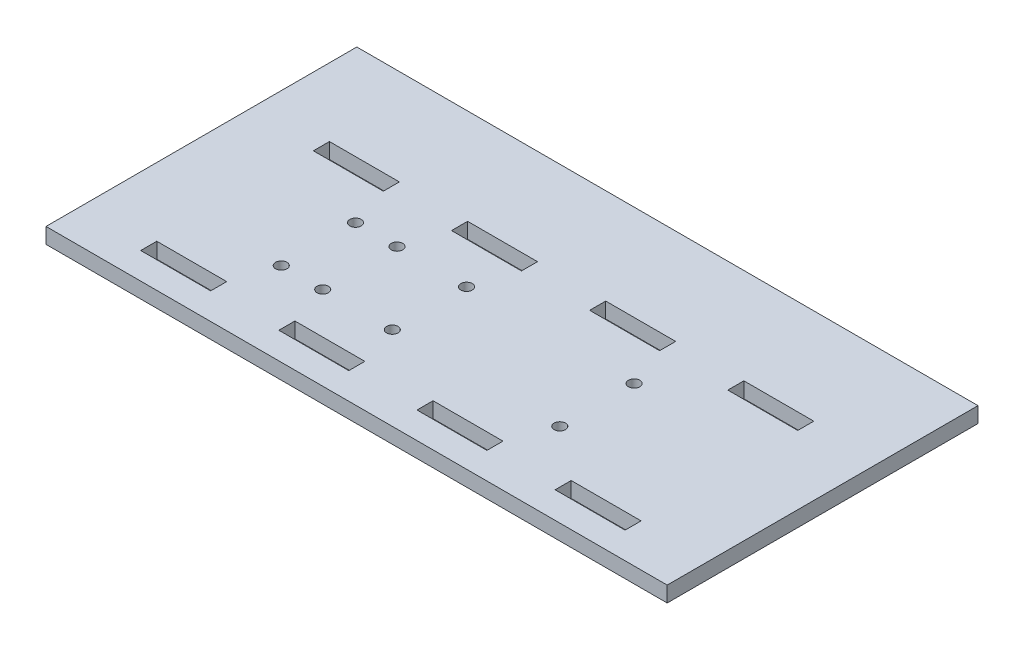
from build123d import *

# Parameters (mm, degrees)
SKETCH2_W           = 220
SKETCH2_H           = 90
BOSS_EXTRUDE1_DEPTH = 4.5
SKETCH3_W           = 20.25
SKETCH3_H           = 4.65
CUT_EXTRUDE1_DEPTH  = 119.933805119
SKETCH5_R           = 1.65
BRACKET_HOLES_DEPTH = 119.933805119
SKETCH6_W           = 59.428711229
SKETCH6_H           = 112.188854202
TRIM_CUT_DEPTH      = 119.933805119


with BuildPart() as part:
    # Sketch2 → Boss-Extrude1 (new body)
    with BuildSketch(Plane(origin=(0, 0, 0), x_dir=(1, 0, 0), z_dir=(0, 1, 0))):
        Rectangle(SKETCH2_W, SKETCH2_H)
    extrude(amount=BOSS_EXTRUDE1_DEPTH)

    # Sketch3 → Cut-Extrude1 (cut, through all)
    with BuildSketch(Plane.XZ):
        with Locations((40, -15)):
            Rectangle(SKETCH3_W, SKETCH3_H)
        with Locations((0, -15)):
            Rectangle(SKETCH3_W, SKETCH3_H)
        with Locations((80, -15)):
            Rectangle(SKETCH3_W, SKETCH3_H)
        with Locations((-80, -15)):
            Rectangle(SKETCH3_W, SKETCH3_H)
        with Locations((-40, -15)):
            Rectangle(SKETCH3_W, SKETCH3_H)
        with Locations((-40, 35)):
            Rectangle(SKETCH3_W, SKETCH3_H)
        with Locations((-80, 35)):
            Rectangle(SKETCH3_W, SKETCH3_H)
        with Locations((80, 35)):
            Rectangle(SKETCH3_W, SKETCH3_H)
        with Locations((40, 35)):
            Rectangle(SKETCH3_W, SKETCH3_H)
        with Locations((0, 35)):
            Rectangle(SKETCH3_W, SKETCH3_H)
    extrude(amount=-CUT_EXTRUDE1_DEPTH, mode=Mode.SUBTRACT)

    # Sketch5 → Bracket holes (cut, through all)
    with BuildSketch(Plane.XZ):
        with Locations((-26, 20.75)):
            Circle(SKETCH5_R)
        with Locations((-14, 20.75)):
            Circle(SKETCH5_R)
        with Locations((6.15, 20.75)):
            Circle(SKETCH5_R)
        with Locations((54.65, 20.75)):
            Circle(SKETCH5_R)
        with Locations((54.65, -0.75)):
            Circle(SKETCH5_R)
        with Locations((6.15, -0.75)):
            Circle(SKETCH5_R)
        with Locations((-14, -0.75)):
            Circle(SKETCH5_R)
        with Locations((-26, -0.75)):
            Circle(SKETCH5_R)
    extrude(amount=-BRACKET_HOLES_DEPTH, mode=Mode.SUBTRACT)

    # Sketch6 → Trim cut (cut, through all)
    with BuildSketch(Plane.XZ):
        with Locations((-99.589355615, -2.07728242)):
            Rectangle(SKETCH6_W, SKETCH6_H)
    extrude(amount=-TRIM_CUT_DEPTH, mode=Mode.SUBTRACT)


solid = part.part
